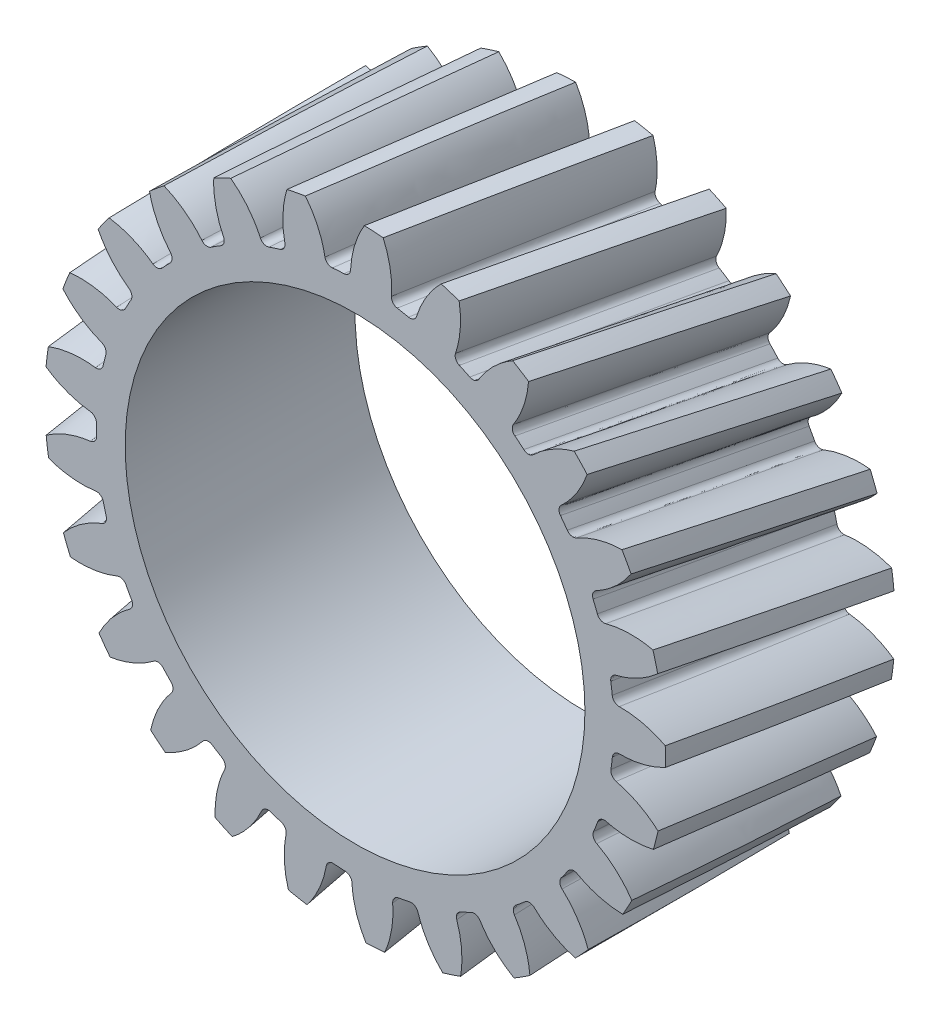
from build123d import *

# Parameters (mm, degrees)
SKETCH1_R                = 27
BOSS_EXTRUDE1_DEPTH      = 10
FILLET1_R                = 0.6
CIRPATTERN2_COUNT        = 25
FILLET1_OF_CIRPATTERN2_R = 0.6
SKETCH6_R                = 20
CUT_EXTRUDE1_DEPTH       = 10


with BuildPart() as part:
    # Sketch1 → Boss-Extrude1 (new, symmetric)
    with BuildSketch(Plane.XY):
        Circle(SKETCH1_R)
    extrude(amount=BOSS_EXTRUDE1_DEPTH, both=True)

    # Sketch4 for Cut-Loft1 → Cut-Loft1 section 0
    with BuildSketch(Plane(origin=(0, 0, 10), x_dir=(0.997865265753493, 0.06530628915128348, 0), z_dir=(0, 0, 1))):
        with BuildLine():
            # circular arc as an exact rational Bezier (weights 1, cos(half-angle), 1)
            Bezier((-3.31531694, 27.803033532), (-1.218687107, 25.549200535), (-1.072022538, 22.474446994), weights=[1, 0.939095418, 1])
            Bezier((-1.072022538, 22.474446994), (0, 22.525582059), (1.072022538, 22.474446994), weights=[1, 0.998864311, 1])
            Bezier((1.072022538, 22.474446994), (1.218687107, 25.549200535), (3.31531694, 27.803033532), weights=[1, 0.939095418, 1])
            Bezier((3.31531694, 27.803033532), (0, 28.198361848), (-3.31531694, 27.803033532), weights=[1, 0.992965483, 1])
        make_face()
    # Sketch2 for Cut-Loft1 → Cut-Loft1 section 1
    with BuildSketch(Plane.XY):
        with BuildLine():
            Bezier((-3.31531694, 27.803033532), (-1.218687107, 25.549200535), (-1.072022538, 22.474446994), weights=[1, 0.939095418, 1])
            Bezier((-1.072022538, 22.474446994), (0, 22.525582059), (1.072022538, 22.474446994), weights=[1, 0.998864311, 1])
            Bezier((1.072022538, 22.474446994), (1.218687107, 25.549200535), (3.31531694, 27.803033532), weights=[1, 0.939095418, 1])
            Bezier((3.31531694, 27.803033532), (0, 28.198361848), (-3.31531694, 27.803033532), weights=[1, 0.992965483, 1])
        make_face()
    # Sketch5 for Cut-Loft1 → Cut-Loft1 section 2
    with BuildSketch(Plane(origin=(0, 0, -10), x_dir=(0.9978652657534929, -0.06530628915128336, 0), z_dir=(0, 0, 1))):
        with BuildLine():
            Bezier((-3.31531694, 27.803033532), (-1.218687107, 25.549200535), (-1.072022538, 22.474446994), weights=[1, 0.939095418, 1])
            Bezier((-1.072022538, 22.474446994), (0, 22.525582059), (1.072022538, 22.474446994), weights=[1, 0.998864311, 1])
            Bezier((1.072022538, 22.474446994), (1.218687107, 25.549200535), (3.31531694, 27.803033532), weights=[1, 0.939095418, 1])
            Bezier((3.31531694, 27.803033532), (0, 28.198361848), (-3.31531694, 27.803033532), weights=[1, 0.992965483, 1])
        make_face()
    cut_loft1 = loft(mode=Mode.SUBTRACT)

    # Fillet1
    fillet1_edges = [part.edges().sort_by_distance(p)[0] for p in [
        (-1.072022538, 22.474446994, 0),
        (1.072022538, 22.474446994, 0),
    ]]
    fillet(fillet1_edges, radius=FILLET1_R)

    # CirPattern2: Cut-Loft1 ×25 about axis
    cirpattern2_axis = Axis((0, 0, 10), (0, 0, -1))
    for i in range(1, CIRPATTERN2_COUNT):
        add(cut_loft1.rotate(cirpattern2_axis, i * 360 / CIRPATTERN2_COUNT), mode=Mode.SUBTRACT)

    # Fillet1 of CirPattern2
    fillet1_of_cirpattern2_edges = [part.edges().sort_by_distance(p)[0] for p in [
        (4.550824708, 22.034972078, 0),
        (6.627510666, 21.50176975, 0),
        (9.887726902, 20.210958827, 0),
        (11.766567924, 19.178057235, 0),
        (14.603346849, 17.117016703, 0),
        (16.166288445, 15.649316851, 0),
        (18.401384806, 12.947549467, 0),
        (19.550221608, 11.137272336, 0),
        (21.043196081, 7.964540081, 0),
        (21.705742446, 5.92543204, 0),
        (22.362785954, 2.481089349, 0),
        (22.497411659, 0.341275057, 0),
        (22.277239742, -3.158257351, 0),
        (21.875485757, -5.264325494, 0),
        (20.791932626, -8.599159126, 0),
        (19.879042632, -10.539149113, 0),
        (18.000191916, -13.499744108, 0),
        (16.63352615, -15.151759232, 0),
        (14.077432948, -17.552090519, 0),
        (12.342864045, -18.812328595, 0),
        (9.270137095, -20.501574531, 0),
        (7.276654398, -21.290850165, 0),
        (3.880364434, -22.162869215, 0),
        (1.753225794, -22.431589318, 0),
        (-1.753225794, -22.431589318, 0),
        (-3.880364434, -22.162869215, 0),
        (-7.276654398, -21.290850165, 0),
        (-9.270137095, -20.501574531, 0),
        (-12.342864045, -18.812328595, 0),
        (-14.077432948, -17.552090519, 0),
        (-16.63352615, -15.151759232, 0),
        (-18.000191916, -13.499744108, 0),
        (-19.879042632, -10.539149113, 0),
        (-20.791932626, -8.599159126, 0),
        (-21.875485757, -5.264325494, 0),
        (-22.277239742, -3.158257351, 0),
        (-22.497411659, 0.341275057, 0),
        (-22.362785954, 2.481089349, 0),
        (-21.705742446, 5.92543204, 0),
        (-21.043196081, 7.964540081, 0),
        (-19.550221608, 11.137272336, 0),
        (-18.401384806, 12.947549467, 0),
        (-16.166288445, 15.649316851, 0),
        (-14.603346849, 17.117016703, 0),
        (-11.766567924, 19.178057235, 0),
        (-9.887726902, 20.210958827, 0),
        (-6.627510666, 21.50176975, 0),
        (-4.550824708, 22.034972078, 0),
    ]]
    fillet(fillet1_of_cirpattern2_edges, radius=FILLET1_OF_CIRPATTERN2_R)

    # Sketch6 → Cut-Extrude1 (cut, symmetric)
    with BuildSketch(Plane.XY):
        Circle(SKETCH6_R)
    extrude(amount=CUT_EXTRUDE1_DEPTH, both=True, mode=Mode.SUBTRACT)


solid = part.part
